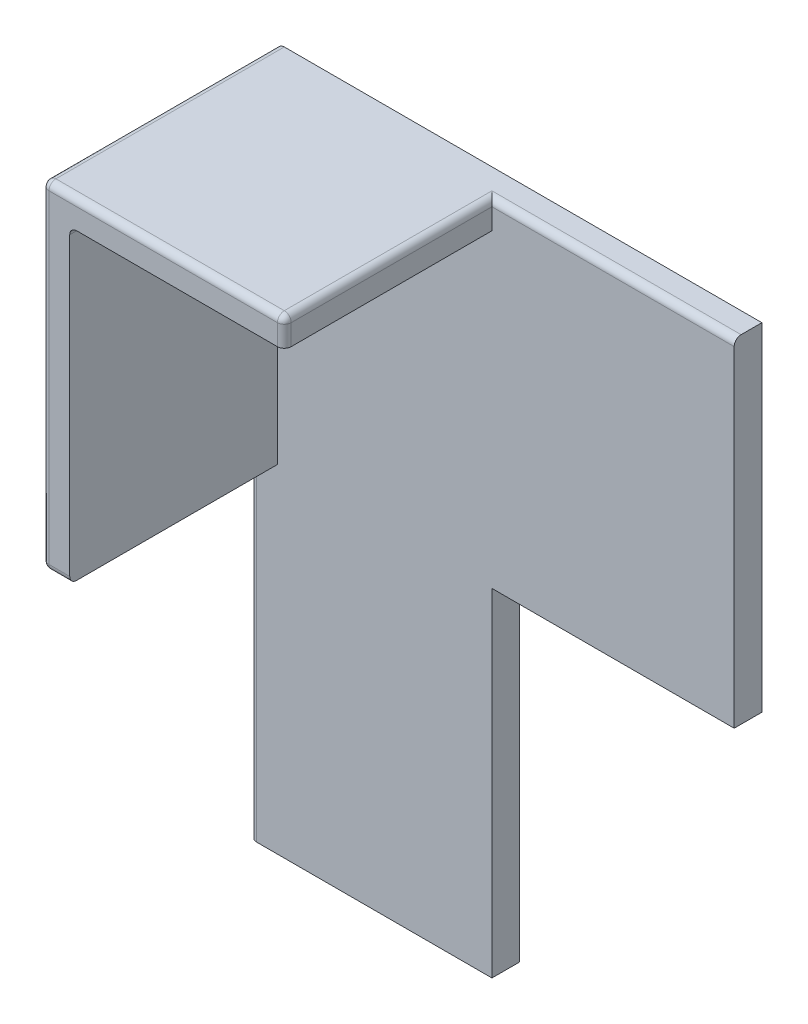
from build123d import *

# Parameters (mm, degrees)
EXTRUDE_1_DEPTH          = 8
CUT_EXTRUDE_2_DEPTH      = 2
CUT_EXTRUDE_2_DEPTH_BACK = 160.263611885
SKETCH_4_R               = 2
CUT_EXTRUDE_7_DEPTH      = 5
SKETCH_5_W               = 8
SKETCH_5_H               = 89.5
EXTRUDE_3_DEPTH          = 60
FILLET_1_R               = 2
FILLET_2_R               = 2
FILLET_3_R               = 2


with BuildPart() as part:
    # 스케치1 → 보스-돌출1 (new body)
    with BuildSketch(Plane.XY):
        Polygon((114.748799453, 110.152671756), (44.748799453, 110.152671756), (-25.251200547, 110.152671756), (-25.251200547, 12.652671756), (44.748799453, 12.652671756), (44.748799453, -84.847328244), (114.748799453, -84.847328244), (114.748799453, 12.652671756), align=None)
    extrude(amount=EXTRUDE_1_DEPTH)

    # 스케치3 → 컷-돌출2 (cut, two sides: drawn at the far end of the back side and taken through both)
    with BuildSketch(Plane.XY.offset(-CUT_EXTRUDE_2_DEPTH_BACK)):
        Polygon((104.248799453, 103.151582842), (105.998799453, 100.120493929), (109.498799453, 100.120493929), (111.248799453, 103.151582842), (109.498799453, 106.182671756), (105.998799453, 106.182671756), align=None)
        Polygon((-21.751200547, 82.151582842), (-20.001200547, 79.120493929), (-16.501200547, 79.120493929), (-14.751200547, 82.151582842), (-16.501200547, 85.182671756), (-20.001200547, 85.182671756), align=None)
        Polygon((-21.751200547, 21.653760669), (-20.001200547, 18.622671756), (-16.501200547, 18.622671756), (-14.751200547, 21.653760669), (-16.501200547, 24.684849582), (-20.001200547, 24.684849582), align=None)
        Polygon((57.998799453, 100.120493929), (61.498799453, 100.120493929), (63.248799453, 103.151582842), (61.498799453, 106.182671756), (57.998799453, 106.182671756), (56.248799453, 103.151582842), align=None)
        Polygon((57.998799453, 93.180493929), (56.248799453, 90.149405016), (57.998799453, 87.118316103), (61.498799453, 87.118316103), (63.248799453, 90.149405016), (61.498799453, 93.180493929), align=None)
        Polygon((104.748799453, -77.846239331), (106.498799453, -80.877328244), (109.998799453, -80.877328244), (111.748799453, -77.846239331), (109.998799453, -74.815150418), (106.498799453, -74.815150418), align=None)
        Polygon((109.498799453, 18.620493929), (111.248799453, 21.651582842), (109.498799453, 24.682671756), (105.998799453, 24.682671756), (104.248799453, 21.651582842), (105.998799453, 18.620493929), align=None)
    extrude(amount=CUT_EXTRUDE_2_DEPTH + CUT_EXTRUDE_2_DEPTH_BACK, mode=Mode.SUBTRACT)

    # 스케치4 → 컷-돌출7 (cut)
    with BuildSketch(Plane(origin=(0, 0, 2), x_dir=(-1, 0, 0), z_dir=(0, 0, -1))):
        with Locations((-59.770469927, 103.152671756)):
            Circle(SKETCH_4_R)
        with Locations((-59.770469927, 90.149405016)):
            Circle(SKETCH_4_R)
        with Locations((-107.759162368, 103.152671756)):
            Circle(SKETCH_4_R)
        with Locations((-108.2480681, -77.845328244)):
            Circle(SKETCH_4_R)
        with Locations((-107.748170768, 21.652671756)):
            Circle(SKETCH_4_R)
        with Locations((18.252457916, 21.653760669)):
            Circle(SKETCH_4_R)
        with Locations((18.2530866, 82.150493929)):
            Circle(SKETCH_4_R)
    extrude(amount=-CUT_EXTRUDE_7_DEPTH, mode=Mode.SUBTRACT)

    # 스케치5 → 보스-돌출3 (add)
    with BuildSketch(Plane.XY.offset(8)):
        Polygon((114.748799453, 102.152671756), (114.748799453, 110.152671756), (44.748799453, 110.152671756), (44.748799453, 102.152671756), (106.748799453, 102.152671756), align=None)
        with Locations((110.748799453, 57.402671756)):
            Rectangle(SKETCH_5_W, SKETCH_5_H)
    extrude(amount=EXTRUDE_3_DEPTH)

    # 필렛1
    fillet_1_edges = [part.edges().sort_by_distance(p)[0] for p in [
        (114.748799453, 110.152671756, 34),
        (9.748799453, 110.152671756, 8),
        (114.748799453, -36.097328244, 8),
        (114.748799453, 61.402671756, 68),
        (79.748799453, 110.152671756, 68),
        (114.748799453, 12.652671756, 38),
        (44.748799453, 110.152671756, 38),
    ]]
    fillet(fillet_1_edges, radius=FILLET_1_R)

    # 필렛2
    # the kernel refuses this fillet: 2 mm, written as the material it takes off along each edge
    with BuildSketch(Plane(origin=(46.748799453, 108.152671756, 66), x_dir=(0, 0, 1), z_dir=(-1, 0, 0))) as fillet_2_piece_1_section:
        Polygon((0, 0), (FILLET_2_R, 0), (FILLET_2_R, FILLET_2_R), (0, FILLET_2_R), align=None)
    fillet_2_piece_1 = extrude(amount=FILLET_2_R, mode=Mode.PRIVATE)
    fillet_2_piece_1 = fillet_2_piece_1 - Plane(origin=(46.748799453, 108.152671756, 66), x_dir=(0, -0.7071067811865475, -0.7071067811865475), z_dir=(-1, 0, 0)) * Sphere(FILLET_2_R, mode=Mode.PRIVATE)
    add(fillet_2_piece_1, mode=Mode.SUBTRACT)
    with BuildSketch(Plane(origin=(112.748799453, 14.652671756, 66), x_dir=(0, 0, 1), z_dir=(0, -1, 0))) as fillet_2_piece_2_section:
        Polygon((0, 0), (FILLET_2_R, 0), (FILLET_2_R, -FILLET_2_R), (0, -FILLET_2_R), align=None)
    fillet_2_piece_2 = extrude(amount=FILLET_2_R, mode=Mode.PRIVATE)
    fillet_2_piece_2 = fillet_2_piece_2 - Plane(origin=(112.748799453, 14.652671756, 66), x_dir=(-0.7071067811865475, 0, -0.7071067811865475), z_dir=(0, -1, 0)) * Sphere(FILLET_2_R, mode=Mode.PRIVATE)
    add(fillet_2_piece_2, mode=Mode.SUBTRACT)
    with BuildSketch(Plane(origin=(101.748799453, 12.652671756, 68), x_dir=(0, 0, -1), z_dir=(1, 0, 0)), Plane(origin=(44.748799453, 108.152671756, 68), x_dir=(0, 0, -1), z_dir=(0, -1, 0))) as fillet_2_piece_3:
        with BuildLine():
            CenterArc((FILLET_2_R, FILLET_2_R), FILLET_2_R, 180, 90)
            Line((0, FILLET_2_R), (0, 0))
            Line((0, 0), (FILLET_2_R, 0))
        make_face()
    extrude(amount=11, mode=Mode.SUBTRACT)

    # 필렛3
    fillet_3_edges = [part.edges().sort_by_distance(p)[0] for p in [
        (106.748799453, 102.152671756, 38),
    ]]
    fillet(fillet_3_edges, radius=FILLET_3_R)


with BuildPart() as body_2:
    # 대칭 복사1: mirrored copy
    add(part.part.mirror(Plane.ZY.offset(35.251200547)))


solid = body_2.part
